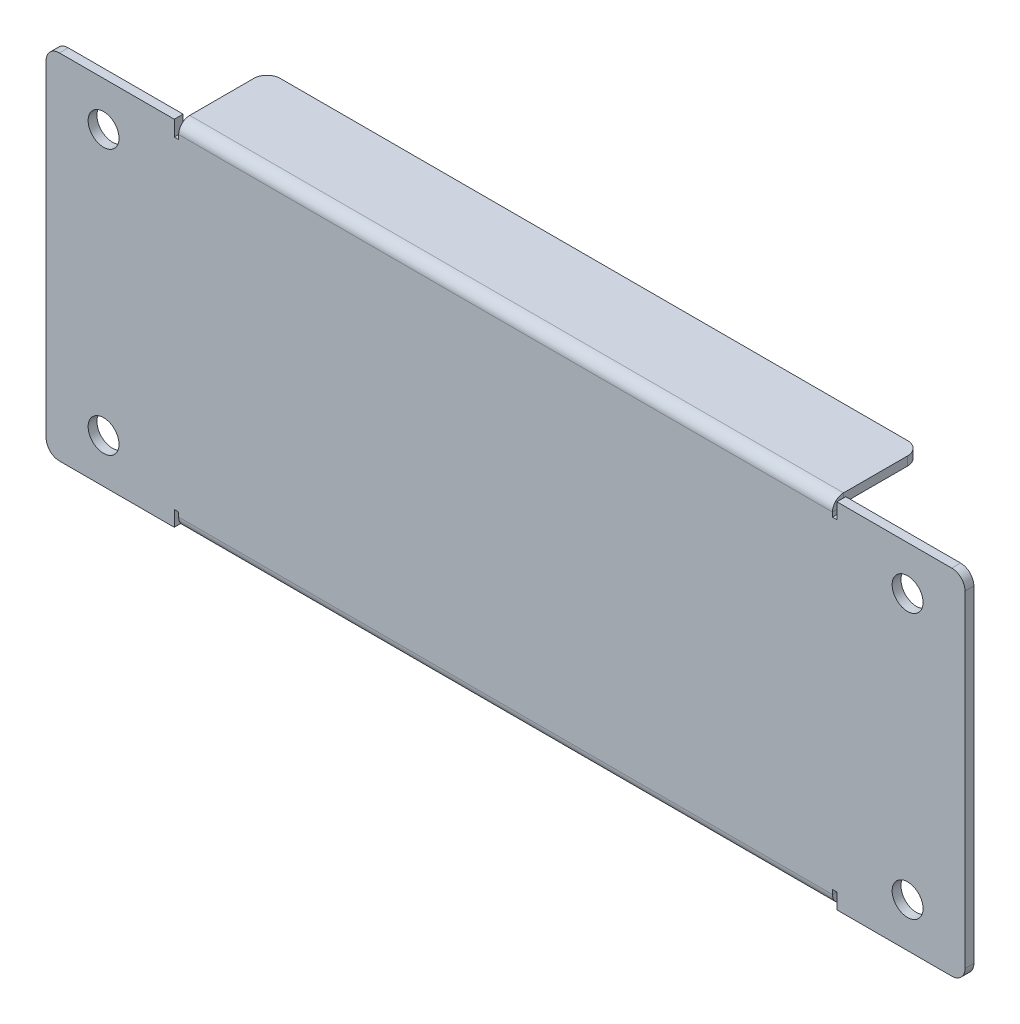
from build123d import *

# Parameters (mm, degrees)
SKETCH_1_W                        = 208
SKETCH_1_H                        = 80
SM_BASE_FLANGE_1_DEPTH            = 2
SM_EDGE_FLANGE_1_STRIP_W          = 9
SM_EDGE_FLANGE_1_STRIP_H          = 2
SM_EDGE_FLANGE_1_STRIP_CUT_DEPTH  = 148
SM_EDGE_FLANGE_1_RELIEF_W         = 10
SM_EDGE_FLANGE_1_RELIEF_H         = 1
SM_EDGE_FLANGE_1_RELIEF_CUT_DEPTH = 2
SM_EDGE_FLANGE_1_DEPTH            = 148
SM_EDGE_FLANGE_2_STRIP_W          = 9
SM_EDGE_FLANGE_2_STRIP_H          = 2
SM_EDGE_FLANGE_2_STRIP_CUT_DEPTH  = 148
SM_EDGE_FLANGE_2_RELIEF_W         = 10
SM_EDGE_FLANGE_2_RELIEF_H         = 1
SM_EDGE_FLANGE_2_RELIEF_CUT_DEPTH = 2
SM_EDGE_FLANGE_2_DEPTH            = 148
SKETCH_10_R                       = 3.5
CUT_EXTRUDE_1_DEPTH               = 114.207773585
FILLET_1_R                        = 3


# Sheet-metal steps are written as plain solids
with BuildPart() as part:
    # Sketch 1 → 基体-法兰1 (new body)
    with BuildSketch(Plane.XY):
        Rectangle(SKETCH_1_W, SKETCH_1_H)
    extrude(amount=-SM_BASE_FLANGE_1_DEPTH)

    # 边线-法兰1 strip (across the edge) → 边线-法兰1 strip cut (cut)
    with BuildSketch(Plane(origin=(-74, 40, -2), x_dir=(0, -1, 0), z_dir=(1, 0, 0))):
        with Locations((-2, -1)):
            Rectangle(SM_EDGE_FLANGE_1_STRIP_W, SM_EDGE_FLANGE_1_STRIP_H)
    extrude(amount=SM_EDGE_FLANGE_1_STRIP_CUT_DEPTH, mode=Mode.SUBTRACT)

    # 边线-法兰1 relief (on the sheet) → 边线-法兰1 relief cut (cut)
    with BuildSketch(Plane(origin=(-74, 37.5, -2), x_dir=(0, -1, 0), z_dir=(0, 0, -1))):
        with Locations((-4, 0.5)):
            Rectangle(SM_EDGE_FLANGE_1_RELIEF_W, SM_EDGE_FLANGE_1_RELIEF_H)
        with Locations((-4, -148.5)):
            Rectangle(SM_EDGE_FLANGE_1_RELIEF_W, SM_EDGE_FLANGE_1_RELIEF_H)
    extrude(amount=-SM_EDGE_FLANGE_1_RELIEF_CUT_DEPTH, mode=Mode.SUBTRACT)

    # 边线-法兰1 section (across the edge) → 边线-法兰1 (add)
    with BuildSketch(Plane(origin=(-74, 40, -2), x_dir=(0, -1, 0), z_dir=(1, 0, 0))):
        with BuildLine():
            Line((0, 0.5), (0, 18))
            Line((0, 18), (2, 18))
            Line((2, 18), (2, 0.5))
            ThreePointArc((2, 0.5), (2.146446609, 0.146446609), (2.5, 0))
            Line((2.5, 0), (2.5, -2))
            ThreePointArc((2.5, -2), (0.732233047, -1.267766953), (0, 0.5))
        make_face()
    extrude(amount=SM_EDGE_FLANGE_1_DEPTH)

    # 边线-法兰2 strip (across the edge) → 边线-法兰2 strip cut (cut)
    with BuildSketch(Plane(origin=(74, -40, -2), x_dir=(0, 1, 0), z_dir=(-1, 0, 0))):
        with Locations((-2, -1)):
            Rectangle(SM_EDGE_FLANGE_2_STRIP_W, SM_EDGE_FLANGE_2_STRIP_H)
    extrude(amount=SM_EDGE_FLANGE_2_STRIP_CUT_DEPTH, mode=Mode.SUBTRACT)

    # 边线-法兰2 relief (on the sheet) → 边线-法兰2 relief cut (cut)
    with BuildSketch(Plane(origin=(74, -37.5, -2), x_dir=(0, 1, 0), z_dir=(0, 0, -1))):
        with Locations((-4, 0.5)):
            Rectangle(SM_EDGE_FLANGE_2_RELIEF_W, SM_EDGE_FLANGE_2_RELIEF_H)
        with Locations((-4, -148.5)):
            Rectangle(SM_EDGE_FLANGE_2_RELIEF_W, SM_EDGE_FLANGE_2_RELIEF_H)
    extrude(amount=-SM_EDGE_FLANGE_2_RELIEF_CUT_DEPTH, mode=Mode.SUBTRACT)

    # 边线-法兰2 section (across the edge) → 边线-法兰2 (add)
    with BuildSketch(Plane(origin=(74, -40, -2), x_dir=(0, 1, 0), z_dir=(-1, 0, 0))):
        with BuildLine():
            Line((0, 0.5), (0, 18))
            Line((0, 18), (2, 18))
            Line((2, 18), (2, 0.5))
            ThreePointArc((2, 0.5), (2.146446609, 0.146446609), (2.5, 0))
            Line((2.5, 0), (2.5, -2))
            ThreePointArc((2.5, -2), (0.732233047, -1.267766953), (0, 0.5))
        make_face()
    extrude(amount=SM_EDGE_FLANGE_2_DEPTH)

    # 草图10 → 切除-拉伸1 (cut, through all)
    with BuildSketch(Plane.XY):
        with Locations((91, -30)):
            Circle(SKETCH_10_R)
        with Locations((91, 30)):
            Circle(SKETCH_10_R)
        with Locations((-91, -30)):
            Circle(SKETCH_10_R)
        with Locations((-91, 30)):
            Circle(SKETCH_10_R)
    extrude(amount=-CUT_EXTRUDE_1_DEPTH, mode=Mode.SUBTRACT)

    # 圆角1
    fillet_1_edges = [part.edges().sort_by_distance(p)[0] for p in [
        (-74, 39, -20),
        (74, 39, -20),
        (104, -40, -1),
        (-104, -40, -1),
        (-104, 40, -1),
        (104, 40, -1),
        (74, -39, -20),
        (-74, -39, -20),
    ]]
    fillet(fillet_1_edges, radius=FILLET_1_R)


solid = part.part
